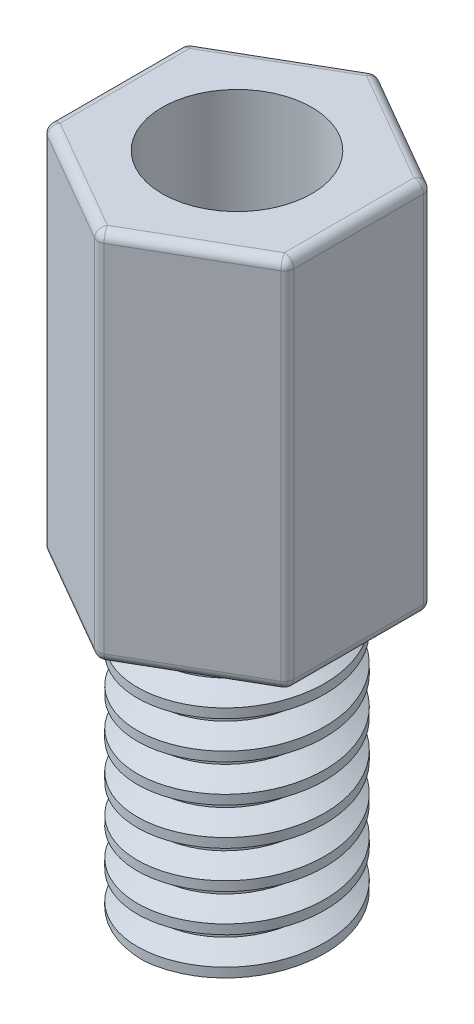
from build123d import *

# Parameters (mm, degrees)
EXTRUDE_1_DEPTH        = 7
HOLE_WIZARD_M2_1_D     = 1.6
HOLE_WIZARD_M2_1_DEPTH = 3.5
HOLE_WIZARD_M2_1_TIP   = 0.480688495
SKETCH_6_R             = 1.943488468
SKETCH_6_R_2           = 1
CUT_EXTRUDE_1_DEPTH    = 3
THREAD_1_PITCH         = 0.4
FILLET_1_R             = 0.1


with BuildPart() as part:
    # 草图1 → 凸台-拉伸1 (new body)
    with BuildSketch(Plane(origin=(0, 0, 0), x_dir=(1, 0, 0), z_dir=(0, 1, 0))):
        Polygon((-1.299038106, 0.75), (0, 1.5), (1.299038106, 0.75), (1.299038106, -0.75), (0, -1.5), (-1.299038106, -0.75), align=None)
    extrude(amount=EXTRUDE_1_DEPTH)

    # M2 螺纹孔1
    with Locations(Plane(origin=(0, 7, 0), x_dir=(1, 0, 0), z_dir=(0, 1, 0))):
        with Locations((0, 0)):
            Hole(HOLE_WIZARD_M2_1_D / 2, depth=HOLE_WIZARD_M2_1_DEPTH)
            with Locations((0, 0, -(HOLE_WIZARD_M2_1_DEPTH + HOLE_WIZARD_M2_1_TIP / 2))):  # 118° drill point
                Cone(0, HOLE_WIZARD_M2_1_D / 2, HOLE_WIZARD_M2_1_TIP, mode=Mode.SUBTRACT)

    # 草图6 → 切除-拉伸1 (cut)
    with BuildSketch(Plane.XZ):
        Circle(SKETCH_6_R)
        with Locations(Location((0, 0, 0), (0, 0, 270))):
            Circle(SKETCH_6_R_2, mode=Mode.SUBTRACT)
    extrude(amount=-CUT_EXTRUDE_1_DEPTH, mode=Mode.SUBTRACT)

    # 螺纹线1: the profile of Sketch 2 profile screwed along a right-hand helix of 9.5 turns, 6 arcs to a turn; built about Z, then put on its axis
    thread_1_z = Axis((0, 0, 0), (0, 0, 1))
    thread_1_corners = [(1.0003, 0, 0.300173206), (0.783493648, 0, 0.175000001), (0.783493648, 0, 0.125000001), (1.0003, 0, -0.000173205)]
    with BuildLine(mode=Mode.PRIVATE) as thread_1_profile:
        Line(thread_1_corners[0], thread_1_corners[1])
        Line(thread_1_corners[1], thread_1_corners[2])
        Line(thread_1_corners[2], thread_1_corners[3])
        Line(thread_1_corners[3], thread_1_corners[0])
    thread_1_cap = Face(thread_1_profile.wire())
    thread_1_turn_angles = [0, 30, 60, 90, 120, 150, 180, 210, 240, 270, 300, 330, 360]
    thread_1_turn_weights = [1, 0.8660254037844387, 1, 0.8660254037844387, 1, 0.8660254037844387, 1, 0.8660254037844387, 1, 0.8660254037844387, 1, 0.8660254037844387, 1]
    thread_1_turn_rails = [Edge.make_bspline([Vector(p[0], p[1], 0).rotate(thread_1_z, thread_1_turn_angles[k]) / thread_1_turn_weights[k] + Vector(0, 0, p[2] + THREAD_1_PITCH * thread_1_turn_angles[k] / 360) for k in range(13)], [0, 0, 0, 1, 1, 2, 2, 3, 3, 4, 4, 5, 5, 6, 6, 6], 2, thread_1_turn_weights) for p in thread_1_corners]
    thread_1_turn_sides = [Face.make_surface_from_curves(thread_1_turn_rails[p[0]], thread_1_turn_rails[p[1]]) for p in [(0, 1), (1, 2), (2, 3), (3, 0)]]
    thread_1_last_angles = [3240, 3270, 3300, 3330, 3360, 3390, 3420]
    thread_1_last_weights = [1, 0.8660254037844387, 1, 0.8660254037844387, 1, 0.8660254037844387, 1]
    thread_1_last_rails = [Edge.make_bspline([Vector(p[0], p[1], 0).rotate(thread_1_z, thread_1_last_angles[k]) / thread_1_last_weights[k] + Vector(0, 0, p[2] + THREAD_1_PITCH * thread_1_last_angles[k] / 360) for k in range(7)], [0, 0, 0, 1, 1, 2, 2, 3, 3, 3], 2, thread_1_last_weights) for p in thread_1_corners]
    thread_1_last_sides = [Face.make_surface_from_curves(thread_1_last_rails[p[0]], thread_1_last_rails[p[1]]) for p in [(0, 1), (1, 2), (2, 3), (3, 0)]]
    thread_1 = Plane(origin=(0, -1, 0), x_dir=(1, 0, 0), z_dir=(0, 1, 0)) * Solid(Shell([*[p.moved(Location((0, 0, THREAD_1_PITCH * i))) for i in range(9) for p in thread_1_turn_sides], *thread_1_last_sides, thread_1_cap, thread_1_cap.rotate(thread_1_z, 3420).moved(Location((0, 0, THREAD_1_PITCH * 3420 / 360)))]))
    add(thread_1, mode=Mode.SUBTRACT)

    # 圆角1
    fillet_1_edges = [part.edges().sort_by_distance(p)[0] for p in [
        (0.649519053, 7, -1.125),
        (0, 5, 1.5),
        (-1.299038106, 5, 0.75),
        (-1.299038106, 5, -0.75),
        (0, 5, -1.5),
        (1.299038106, 5, -0.75),
        (1.299038106, 5, 0.75),
        (-0.649519053, 7, -1.125),
        (-1.299038106, 7, 0),
        (-0.649519053, 7, 1.125),
        (-0.649519053, 3, 1.125),
        (1.299038106, 3, 0),
        (0.649519053, 3, 1.125),
        (-1.299038106, 3, 0),
        (-0.649519053, 3, -1.125),
        (0.649519053, 3, -1.125),
        (0.649519053, 7, 1.125),
        (1.299038106, 7, 0),
    ]]
    fillet(fillet_1_edges, radius=FILLET_1_R)


solid = part.part
